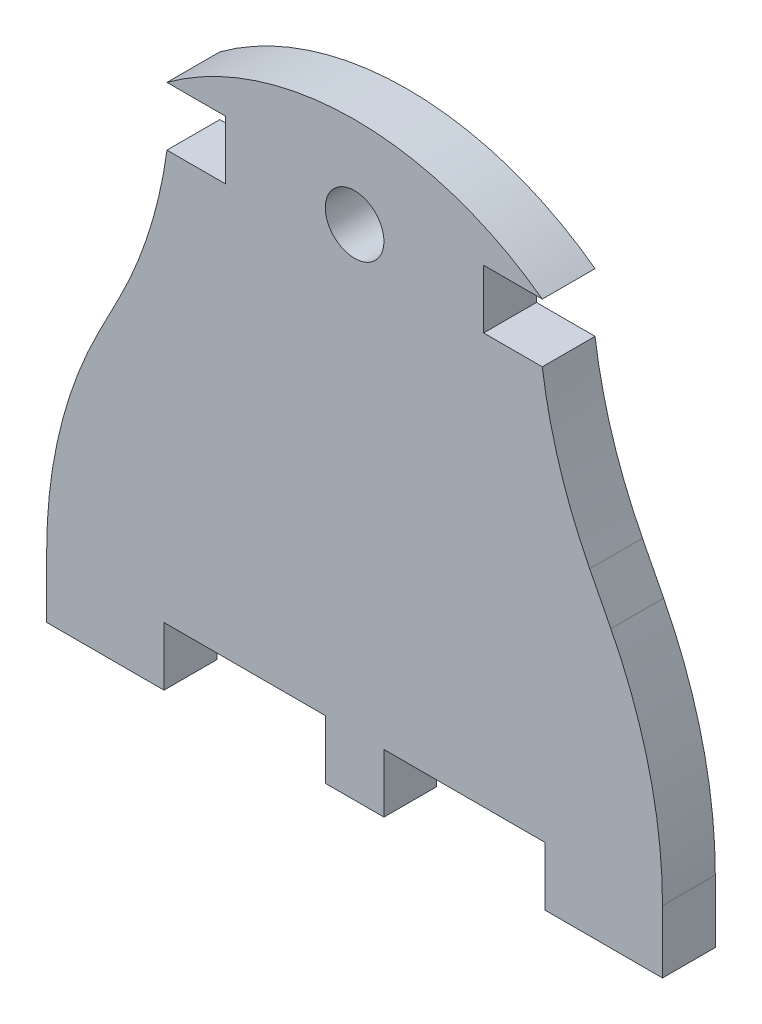
from build123d import *

# Parameters (mm, degrees)
SKETCH1_R           = 2.5
BOSS_EXTRUDE1_DEPTH = 4.5
FILLET1_R           = 40
SKETCH2_W           = 5
SKETCH2_H           = 4.5
BOSS_EXTRUDE2_DEPTH = 5
CHAMFER1_SIZE       = 6
FILLET2_R           = 30
CUT_EXTRUDE1_DEPTH  = 10


# Some blends are built 0.0001 mm under size
with BuildPart() as part:
    # Sketch1 → Boss-Extrude1 (new body)
    with BuildSketch(Plane.XY):
        Polygon((-16.25, 10.704231142), (-16.25, 15.704231142), (16.25, 15.704231142), (16.25, 10.704231142), (26.25, 10.704231142), (26.25, 25.704231142), (16, 45.704231142), (16, 50.704231142), (11, 50.704231142), (11, 55.704231142), (16, 55.704231142), (16, 61.704231142), (-16, 61.704231142), (-16, 55.704231142), (-11, 55.704231142), (-11, 50.704231142), (-16, 50.704231142), (-16, 45.704231142), (-26.25, 25.704231142), (-26.25, 10.704231142), align=None)
        with Locations((0, 53.212370659)):
            Circle(SKETCH1_R, mode=Mode.SUBTRACT)
    extrude(amount=BOSS_EXTRUDE1_DEPTH)

    # Fillet1
    # the kernel refuses this fillet: 40 mm, written as the material it adds along each edge
    with BuildSketch(Plane(origin=(-16, 45.704231142, 0), x_dir=(0, 1, 0), z_dir=(0, 0, 1))) as fillet1_piece_1:
        with BuildLine():
            CenterArc((10.355860331, 39.639812816), FILLET1_R, 242.864860378, 19.440324463)
            Line((-7.887771306, 4.042482794), (0, 0))
            Line((0, 0), (5, 0))
        make_face()
    extrude(amount=4.5)
    with BuildSketch(Plane(origin=(16, 45.704231142, 0), x_dir=(0.4560907909103989, -0.8899332505568757, 0), z_dir=(0, 0, 1))) as fillet1_piece_2:
        with BuildLine():
            CenterArc((8.863329132, 40), FILLET1_R, 250.559675537, 19.440324463)
            Line((-4.449666253, 2.280453955), (0, 0))
            Line((0, 0), (8.863329132, 0))
        make_face()
    extrude(amount=4.5)
    # the kernel refuses this fillet: 40 mm, written as the material it takes off along each edge
    with BuildSketch(Plane(origin=(-26.25, 25.704231142, -24.132640175), x_dir=(0, -1, 0), z_dir=(0, 0, 1))) as fillet1_2_piece_1:
        with BuildLine():
            CenterArc((FILLET1_R * 0.241326401753, FILLET1_R), FILLET1_R, 242.864860378, 27.135139622)
            Line((-FILLET1_R * 0.214764389157, FILLET1_R * 0.110066749443), (0, 0))
            Line((0, 0), (FILLET1_R * 0.241326401753, 0))
        make_face()
    extrude(amount=52.765280351, mode=Mode.SUBTRACT)
    with BuildSketch(Plane(origin=(26.25, 25.704231142, -24.132640175), x_dir=(0, -1, 0), z_dir=(0, 0, 1))) as fillet1_2_piece_2:
        with BuildLine():
            CenterArc((FILLET1_R * 0.241326401753, -FILLET1_R), FILLET1_R, 90, 27.135139622)
            Line((-FILLET1_R * 0.214764389157, -FILLET1_R * 0.110066749443), (0, 0))
            Line((0, 0), (FILLET1_R * 0.241326401753, 0))
        make_face()
    extrude(amount=52.765280351, mode=Mode.SUBTRACT)

    # Sketch2 → Boss-Extrude2 (add)
    with BuildSketch(Plane.XZ.offset(-15.704231142)):
        with Locations((0, 2.25)):
            Rectangle(SKETCH2_W, SKETCH2_H)
    extrude(amount=BOSS_EXTRUDE2_DEPTH)

    # Chamfer1
    chamfer1_edges = [part.edges().sort_by_distance(p)[0] for p in [
        (16, 61.704231142, 2.25),
        (-16, 61.704231142, 2.25),
    ]]
    chamfer(chamfer1_edges, length=CHAMFER1_SIZE - 0.0001)  # a hair under: the kernel refuses the full size

    # Fillet2
    # the kernel refuses this fillet: 30 mm, written as the material it takes off along each edge
    with BuildSketch(Plane(origin=(10.0001, 61.704231142, -29.999916665), x_dir=(-1, 0, 0), z_dir=(0, 0, 1))) as fillet2_piece_1:
        with BuildLine():
            CenterArc((11.999966666, 30), FILLET2_R, 233.130420665, 36.869579335)
            Line((-5.9999, 5.9999), (-6.359897333, 5.519898))
            ThreePointArc((-6.359897333, 5.519898), (-3.424214069, 2.575685931), (-0.424264069, -0.424264069))
            Line((-0.424264069, -0.424264069), (0, -0.6))
            Line((0, -0.6), (11.999966666, -0.6))
            Line((11.999966666, -0.6), (11.999966666, 0))
        make_face()
    extrude(amount=64.499833329, mode=Mode.SUBTRACT)
    with BuildSketch(Plane(origin=(-10.0001, 61.704231142, -29.999916665), x_dir=(-0.7071067811865477, -0.7071067811865472, 0), z_dir=(0, 0, 1))) as fillet2_piece_2:
        with BuildLine():
            CenterArc((12.727945632, 29.698461239), FILLET2_R, 225, 36.869579335)
            Line((-8.485257803, 8.485257803), (-8.909521872, 8.060993735))
            Line((-8.909521872, 8.060993735), (-0.424264069, -0.424264069))
            Line((-0.424264069, -0.424264069), (0, -0.6))
            ThreePointArc((0, -0.6), (4.242569976, -0.6), (8.400283839, -0.593969225))
            Line((8.400283839, -0.593969225), (8.485139953, 0))
        make_face()
    extrude(amount=64.499833329, mode=Mode.SUBTRACT)

    # Sketch3 → Cut-Extrude1 (cut)
    with BuildSketch(Plane.XY.offset(4.5)):
        with BuildLine():
            ThreePointArc((-16, 55.704231142), (0, 60.96256169), (16, 55.704231142))
            ThreePointArc((16, 55.704231142), (0, 69.243827032), (-16, 55.704231142))
        make_face()
    extrude(amount=-CUT_EXTRUDE1_DEPTH, mode=Mode.SUBTRACT)


solid = part.part
